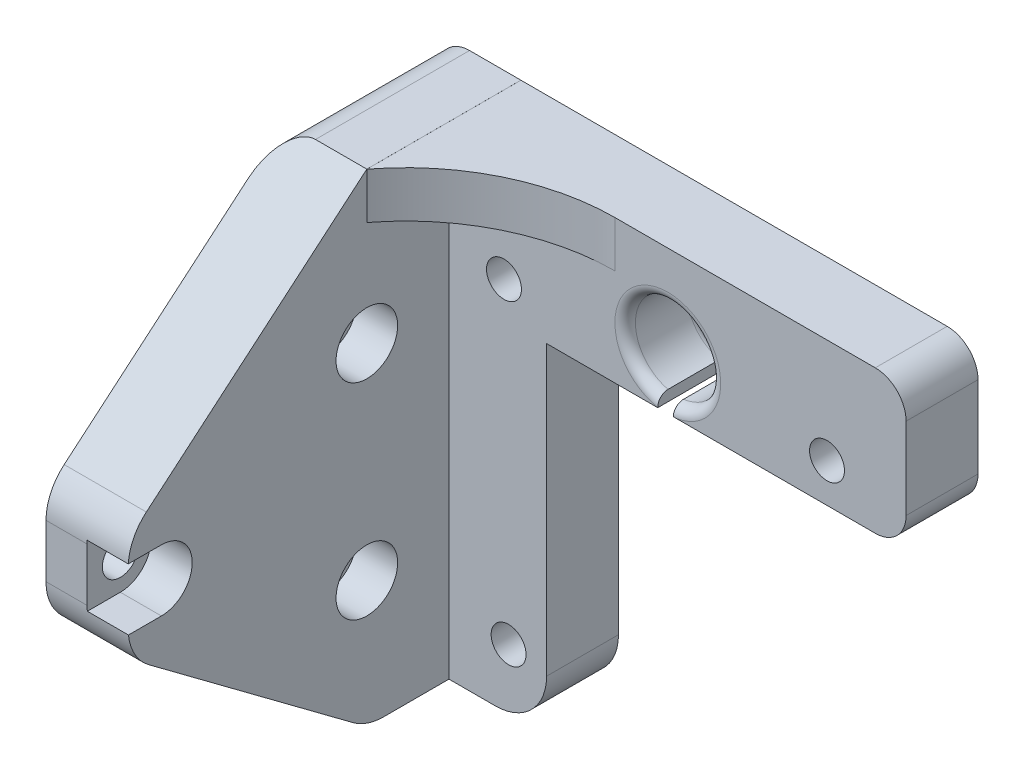
from build123d import *

# Parameters (mm, degrees)
SKETCH50_R         = 1.75
EXTRUDE1_DEPTH     = 8
SKETCH52_R         = 4.15
SKETCH52_R_2       = 1.7
EXTRUDE2_DEPTH     = 7
FILLET1_R          = 3
FILLET2_R          = 5
EXTRUDE3_DEPTH     = 4.5
FILLET4_R          = 5
FILLET5_R          = 3
SKETCH55_R         = 3
CUT_EXTRUDE3_DEPTH = 4
FILLET9_R          = 1
FILLET10_R         = 1
SKETCH57_W         = 1
SKETCH57_H         = 8.155835086
EXTRUDE4_DEPTH     = 4
CUT_EXTRUDE4_START = -7
SKETCH56_W         = 0.996940693
SKETCH56_H         = 2.63977817
CUT_EXTRUDE4_DEPTH = 7.000001


with BuildPart() as part:
    # Sketch50 → Extrude1 (new body)
    with BuildSketch(Plane(origin=(60, 0, 0), x_dir=(0, 0, -1), z_dir=(1, 0, 0))):
        Polygon((-38.234887292, -28), (-38.234887292, -38), (-15, -55.32486375), (0, -55.32486375), (0, -8.32486375), (-15, -8.32486375), align=None)
        with Locations((-35, -33)):
            Circle(SKETCH50_R, mode=Mode.SUBTRACT)
        with Locations((-15, -23)):
            Circle(SKETCH50_R, mode=Mode.SUBTRACT)
        with Locations((-15, -43)):
            Circle(SKETCH50_R, mode=Mode.SUBTRACT)
    extrude(amount=EXTRUDE1_DEPTH)

    # Sketch52 → Extrude2 (add)
    with BuildSketch(Plane(origin=(0, 0, 0), x_dir=(-1, 0, 0), z_dir=(0, 0, -1))):
        Polygon((-61.521067729, -55.328445544), (-61.521067729, -8.328445544), (-112.5, -8.328445544), (-112.5, -22.280627193), (-77.5, -22.280627193), (-77.5, -55.328445544), align=None)
        with Locations(Location((-89.299980942, -17.200015896, 0), (0, 0, 90))):
            Circle(SKETCH52_R, mode=Mode.SUBTRACT)
        with Locations(Location((-73.351535893, -18.931266408, 0), (0, 0, 90))):
            Circle(SKETCH52_R_2, mode=Mode.SUBTRACT)
        with Locations(Location((-104.8, -18.5, 0), (0, 0, 90))):
            Circle(SKETCH52_R_2, mode=Mode.SUBTRACT)
        with Locations(Location((-73.801481725, -49.508569042, 0), (0, 0, 90))):
            Circle(SKETCH52_R_2, mode=Mode.SUBTRACT)
    extrude(amount=-EXTRUDE2_DEPTH)

    # Fillet1
    fillet1_edges = [part.edges().sort_by_distance(p)[0] for p in [
        (112.5, -22.280627193, 3.5),
        (112.5, -8.328445544, 3.5),
    ]]
    fillet(fillet1_edges, radius=FILLET1_R)

    # Fillet2
    fillet2_edges = [part.edges().sort_by_distance(p)[0] for p in [
        (77.5, -55.328445544, 3.5),
    ]]
    fillet(fillet2_edges, radius=FILLET2_R)

    # Sketch54 → Extrude3 (add)
    with BuildSketch(Plane(origin=(0, -8.328445544, 0), x_dir=(1, 0, 0), z_dir=(0, 1, 0))):
        with BuildLine():
            Line((68, -15), (68, -7))
            Line((68, -7), (84.179453899, -7))
            ThreePointArc((84.179453899, -7), (75.154838555, -9.109252039), (68, -15))
        make_face()
    extrude(amount=-EXTRUDE3_DEPTH)

    # Fillet4
    fillet4_edges = [part.edges().sort_by_distance(p)[0] for p in [
        (64, -55.32486375, 15),
        (64, -38, 38.234887292),
        (64, -28, 38.234887292),
    ]]
    fillet(fillet4_edges, radius=FILLET4_R)

    # Fillet5
    fillet5_edges = [part.edges().sort_by_distance(p)[0] for p in [
        (60, -8.32486375, 7.5),
    ]]
    fillet(fillet5_edges, radius=FILLET5_R)

    # Sketch55 → Cut-Extrude3 (cut)
    with BuildSketch(Plane(origin=(68, 0, 0), x_dir=(0, 0, -1), z_dir=(1, 0, 0))):
        with Locations((-15, -23)):
            Circle(SKETCH55_R)
        with Locations((-15, -43)):
            Circle(SKETCH55_R)
        with BuildLine():
            Line((-35, -30), (-38.787900912, -30))
            Line((-38.787900912, -30), (-38.787900912, -36))
            Line((-38.787900912, -36), (-35, -36))
            ThreePointArc((-35, -36), (-32, -33), (-35, -30))
        make_face()
    extrude(amount=-CUT_EXTRUDE3_DEPTH, mode=Mode.SUBTRACT)

    # Fillet9
    # the kernel refuses this fillet: 1 mm, written as the material it takes off along each edge
    with BuildSketch(Plane(origin=(89.299980942, -17.200015896, 0), x_dir=(0, 1, 0), z_dir=(-1, 0, 0))) as fillet9_piece_1:
        with BuildLine():
            CenterArc((4.15 + FILLET9_R, -FILLET9_R), FILLET9_R, 90, 90)
            Line((4.15, -FILLET9_R), (4.15, 0))
            Line((4.15, 0), (4.15 + FILLET9_R, 0))
        make_face()
    revolve(axis=Axis((89.299980942, -17.200015896, 0), (0, 0, -1)), mode=Mode.SUBTRACT)

    # Fillet10
    # the kernel refuses this fillet: 1 mm, written as the material it takes off along each edge
    with BuildSketch(Plane(origin=(89.299980942, -17.200015896, 7), x_dir=(0, 1, 0), z_dir=(-1, 0, 0))) as fillet10_piece_1:
        with BuildLine():
            CenterArc((4.15 + FILLET10_R, FILLET10_R), FILLET10_R, 180, 90)
            Line((4.15, FILLET10_R), (4.15, 0))
            Line((4.15, 0), (4.15 + FILLET10_R, 0))
        make_face()
    revolve(axis=Axis((89.299980942, -17.200015896, 7), (0, 0, -1)), mode=Mode.SUBTRACT)

    # Sketch57 → Extrude4 (cut)
    with BuildSketch(Plane.XZ.offset(22.280627193)):
        with Locations((89.327585964, 3.449545077)):
            Rectangle(SKETCH57_W, SKETCH57_H)
    extrude(amount=-EXTRUDE4_DEPTH, mode=Mode.SUBTRACT)

    # Sketch56 → Cut-Extrude4 (cut)
    with BuildSketch(Plane(origin=(0, 0, 0), x_dir=(-1, 0, 0), z_dir=(0, 0, -1)).offset(CUT_EXTRUDE4_START)):
        with Locations((-88.818861809, -22.280627193)):
            Rectangle(SKETCH56_W, SKETCH56_H)
    extrude(amount=CUT_EXTRUDE4_DEPTH, mode=Mode.SUBTRACT)


solid = part.part
